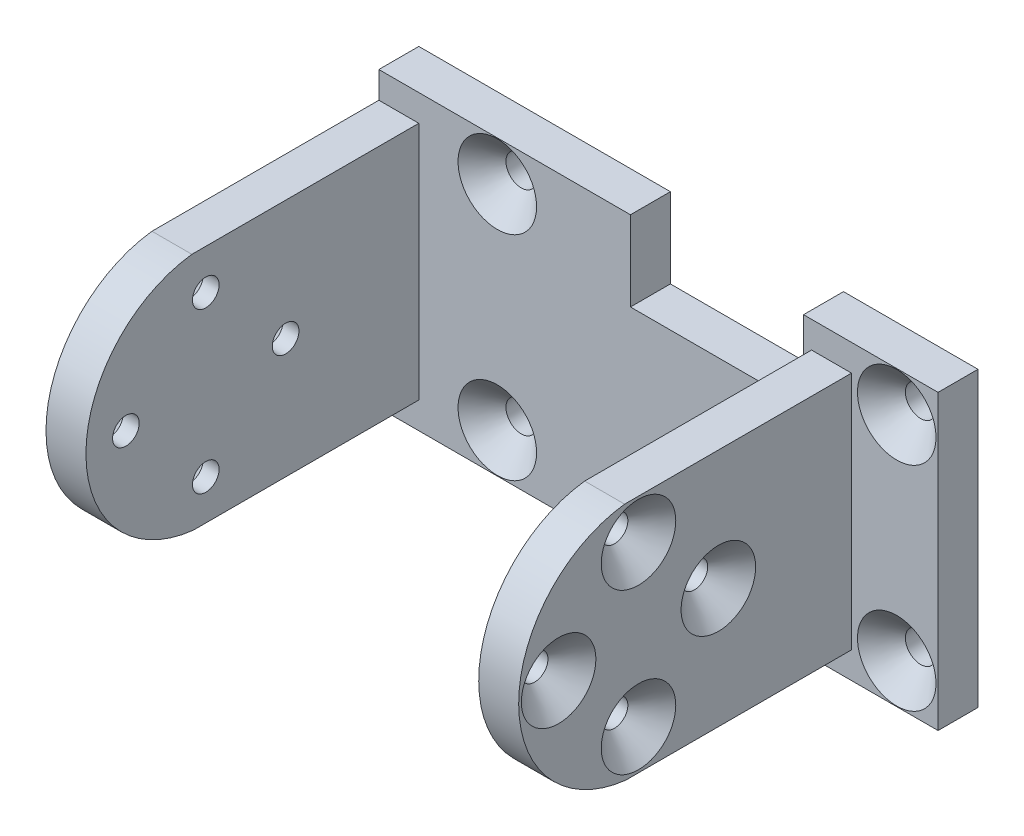
from build123d import *

# Parameters (mm, degrees)
SKETCH1_W                                       = 42
SKETCH1_H                                       = 22
BOSS_EXTRUDE1_DEPTH                             = 3
SKETCH2_W                                       = 13
SKETCH2_H                                       = 6
CUT_EXTRUDE1_DEPTH                              = 233.19450244
SKETCH3_W                                       = 13
SKETCH3_H                                       = 6
CUT_EXTRUDE2_DEPTH                              = 233.19450244
BOSS_EXTRUDE2_DEPTH                             = 3
BOSS_EXTRUDE3_START                             = -3
BOSS_EXTRUDE3_DEPTH                             = 3
F_2_0_2_DIAMETER_HOLE1_D                        = 2
F_2_0_2_DIAMETER_HOLE1_DEPTH                    = 3
F_2_0_2_DIAMETER_HOLE1_CSINK_D                  = 5.6
F_2_0_2_DIAMETER_HOLE1_CSINK_ANGLE              = 90
CSK_FOR_M2_FLAT_HEAD_MACHINE_SCREW1_D           = 2.3
CSK_FOR_M2_FLAT_HEAD_MACHINE_SCREW1_CSINK_D     = 5.9
CSK_FOR_M2_FLAT_HEAD_MACHINE_SCREW1_CSINK_ANGLE = 90
F_2_0_2_DIAMETER_HOLE2_D                        = 2
F_2_0_2_DIAMETER_HOLE2_DEPTH                    = 42
F_2_0_2_DIAMETER_HOLE2_CSINK_D                  = 5.6
F_2_0_2_DIAMETER_HOLE2_CSINK_ANGLE              = 90


with BuildPart() as part:
    # Sketch1 → Boss-Extrude1 (new body)
    with BuildSketch(Plane.XY.offset(163.526991532)):
        with Locations((15.20664665, 218.33461514)):
            Rectangle(SKETCH1_W, SKETCH1_H)
    extrude(amount=-BOSS_EXTRUDE1_DEPTH)

    # Sketch2 → Cut-Extrude1 (cut, through all)
    with BuildSketch(Plane(origin=(0, 0, 160.526991532), x_dir=(-1, 0, 0), z_dir=(0, 0, -1))):
        with Locations((-19.603323325, 226.33461514)):
            Rectangle(SKETCH2_W, SKETCH2_H)
    extrude(amount=-CUT_EXTRUDE1_DEPTH, mode=Mode.SUBTRACT)

    # Sketch3 → Cut-Extrude2 (cut, through all)
    with BuildSketch(Plane(origin=(0, 0, 160.526991532), x_dir=(-1, 0, 0), z_dir=(0, 0, -1))):
        with Locations((-19.603323325, 210.33461514)):
            Rectangle(SKETCH3_W, SKETCH3_H)
    extrude(amount=-CUT_EXTRUDE2_DEPTH, mode=Mode.SUBTRACT)

    # Sketch4 → Boss-Extrude2 (add)
    with BuildSketch(Plane(origin=(-5.79335335, 0, 0), x_dir=(0, -1, 0), z_dir=(-1, 0, 0))):
        with BuildLine():
            Line((-227.33461514, 180.570138914), (-227.33461514, 163.526991532))
            Line((-227.33461514, 163.526991532), (-209.33461514, 163.526991532))
            Line((-209.33461514, 163.526991532), (-209.33461514, 180.47391761))
            ThreePointArc((-209.33461514, 180.47391761), (-218.291824267, 188.52686382), (-227.33461514, 180.570138914))
        make_face()
    extrude(amount=-BOSS_EXTRUDE2_DEPTH)

    # Sketch5 → Boss-Extrude3 (add)
    with BuildSketch(Plane(origin=(29.70664665, 0, 0), x_dir=(0, 0, -1), z_dir=(1, 0, 0)).offset(BOSS_EXTRUDE3_START)):
        with BuildLine():
            Line((-180.47391761, 209.33461514), (-163.526991532, 209.33461514))
            Line((-163.526991532, 209.33461514), (-163.526991532, 227.33461514))
            Line((-163.526991532, 227.33461514), (-180.570138914, 227.33461514))
            ThreePointArc((-180.570138914, 227.33461514), (-188.52686382, 218.291824267), (-180.47391761, 209.33461514))
        make_face()
    extrude(amount=BOSS_EXTRUDE3_DEPTH)

    # Ø2.0 (2) Diameter Hole1
    with Locations(Plane(origin=(29.70664665, 0, 0), x_dir=(0, 0, -1), z_dir=(1, 0, 0))):
        with Locations((-179.527190494, 224.334217217), (-185.526991532, 218.334416179), (-179.527190494, 212.33461514), (-173.527389456, 218.334416179)):
            CounterSinkHole(F_2_0_2_DIAMETER_HOLE1_D / 2, F_2_0_2_DIAMETER_HOLE1_CSINK_D / 2, depth=F_2_0_2_DIAMETER_HOLE1_DEPTH, counter_sink_angle=F_2_0_2_DIAMETER_HOLE1_CSINK_ANGLE)

    # CSK for M2 Flat Head Machine Screw1 (through all)
    with Locations(Plane.XY.offset(163.526991532)):
        with Locations((3.103323325, 226.326974637), (3.103323325, 210.326974637), (33.103323325, 210.326974637), (33.103323325, 226.326974637)):
            CounterSinkHole(CSK_FOR_M2_FLAT_HEAD_MACHINE_SCREW1_D / 2, CSK_FOR_M2_FLAT_HEAD_MACHINE_SCREW1_CSINK_D / 2, counter_sink_angle=CSK_FOR_M2_FLAT_HEAD_MACHINE_SCREW1_CSINK_ANGLE)

    # Ø2.0 (2) Diameter Hole2
    with Locations(Plane.ZY.offset(5.79335335)):
        with Locations((179.527190494, 224.334217217), (185.526991532, 218.334416179), (179.527190494, 212.33461514), (173.527389456, 218.334416179)):
            CounterSinkHole(F_2_0_2_DIAMETER_HOLE2_D / 2, F_2_0_2_DIAMETER_HOLE2_CSINK_D / 2, depth=F_2_0_2_DIAMETER_HOLE2_DEPTH, counter_sink_angle=F_2_0_2_DIAMETER_HOLE2_CSINK_ANGLE)


solid = part.part
